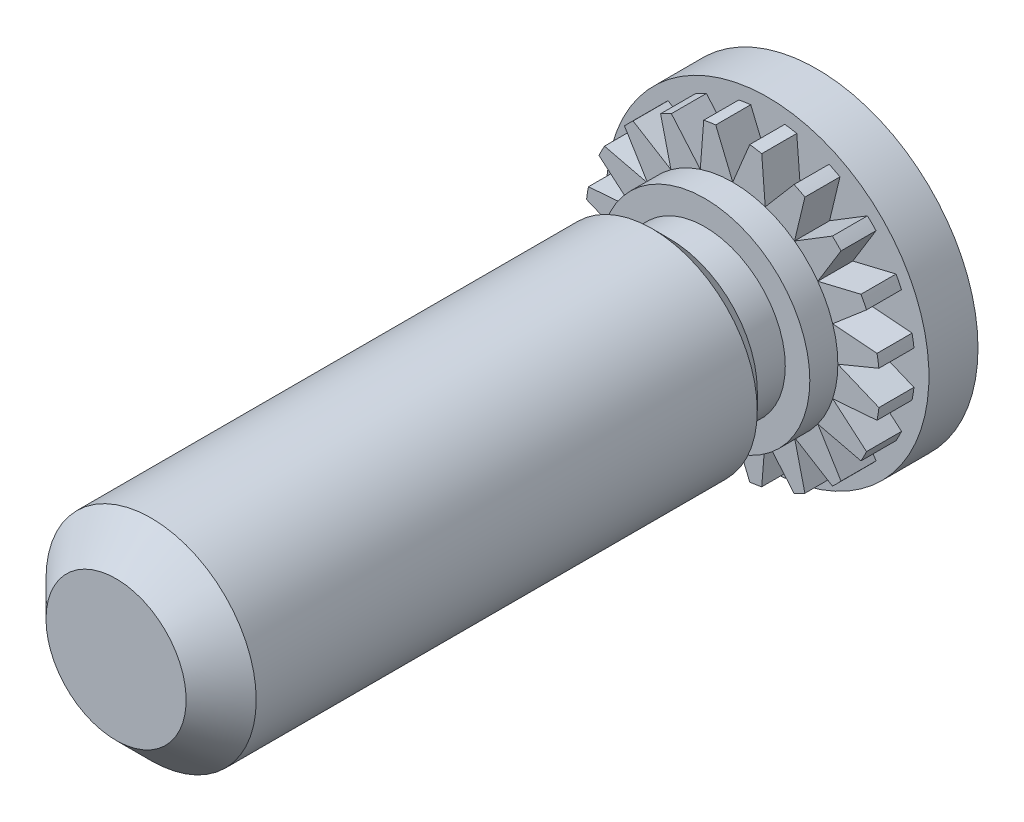
from build123d import *

# Parameters (mm, degrees)
SKETCH_1_R               = 2.3
EXTRUDE_1_DEPTH          = 1.2
SKETCH_2_R               = 1.5
EXTRUDE_2_DEPTH          = 1.5
CUT_EXTRUDE_1_DEPTH      = 0.5
PATTERN_CIRCULAR_1_COUNT = 20
SKETCH_4_W               = 0.35
SKETCH_4_H               = 0.5
SKETCH_6_W               = 7.3
SKETCH_6_H               = 1.5
CHAMFER_2_SIZE           = 0.5
CUT_EXTRUDE_START        = -0.5
SKETCH_7_R               = 2.3
SKETCH_7_R_2             = 2.1
CUT_EXTRUDE_2_DEPTH      = 0.5


with BuildPart() as part:
    # Эскиз1 → Вытянуть1 (new body)
    with BuildSketch(Plane.XY):
        Circle(SKETCH_1_R)
    extrude(amount=EXTRUDE_1_DEPTH)

    # Эскиз2 → Вытянуть2 (add)
    with BuildSketch(Plane.XY.offset(1.2)):
        Circle(SKETCH_2_R)
    extrude(amount=EXTRUDE_2_DEPTH)

    # Эскиз3 → Вырез-Вытянуть1 (cut)
    with BuildSketch(Plane.XY.offset(1.2)):
        Polygon((-0.33137085, 2.3), (0.33137085, 2.3), (0, 1.5), align=None)
    cut_extrude_1 = extrude(amount=-CUT_EXTRUDE_1_DEPTH, mode=Mode.SUBTRACT)

    # Круговой массив1: Вырез-Вытянуть1 ×20 about axis
    pattern_circular_1_axis = Axis((0, 0, 0), (0, 0, 1))
    for i in range(1, PATTERN_CIRCULAR_1_COUNT):
        add(cut_extrude_1.rotate(pattern_circular_1_axis, i * 360 / PATTERN_CIRCULAR_1_COUNT), mode=Mode.SUBTRACT)

    # Эскиз4 → Вырез-Повернуть1 (revolve, cut)
    with BuildSketch(Plane(origin=(0, 0, 0), x_dir=(1, 0, 0), z_dir=(0, 1, 0))):
        with Locations((1.325, -1.85)):
            Rectangle(SKETCH_4_W, SKETCH_4_H)
    revolve(axis=Axis((0, 0, 10.642619983), (0, 0, -1)), mode=Mode.SUBTRACT)

    # Эскиз6 → Повернуть1 (revolve)
    with BuildSketch(Plane(origin=(0, 0, 0), x_dir=(0, 0, -1), z_dir=(1, 0, 0)), mode=Mode.PRIVATE) as revolve_1_sk:
        with Locations((-6.35, -0.75)):
            Rectangle(SKETCH_6_W, SKETCH_6_H)
    revolve(revolve_1_sk.sketch.rotate(Axis((0, 0, 2.7), (0, 0, 1)), 278.047567557), axis=Axis((0, 0, 2.7), (0, 0, 1)))

    # Фаска2
    # the kernel refuses this chamfer: 0.5 mm, written as the material it takes off along each edge
    with BuildSketch(Plane(origin=(0, 0, 10), x_dir=(-0.9901521845161062, -0.1399951838385265, 0), z_dir=(-0.1399951838385265, 0.9901521845161062, 0))) as chamfer_2_piece_1:
        Polygon((1.5, -CHAMFER_2_SIZE), (1.5 - CHAMFER_2_SIZE, 0), (1.5, 0), align=None)
    revolve(axis=Axis((0, 0, 10), (0, 0, 1)), mode=Mode.SUBTRACT)

    # Эскиз7 → Вырез-Вытянуть2 (cut)
    with BuildSketch(Plane.XY.offset(1.2).offset(CUT_EXTRUDE_START)):
        with Locations(Location((0, 0, 0), (0, 0, 180))):
            Circle(SKETCH_7_R)
        Circle(SKETCH_7_R_2, mode=Mode.SUBTRACT)
    extrude(amount=CUT_EXTRUDE_2_DEPTH, mode=Mode.SUBTRACT)

    # Фаска3
    # the kernel refuses this chamfer: 0.25 mm, written as the material it takes off along each edge
    with BuildSketch(Plane(origin=(0, 0, 2.1), x_dir=(1, 0, 0), z_dir=(0, 1, 0))) as chamfer_3_piece_1:
        with BuildLine():
            Line((1.242928932, 0.007071068), (1.507071068, -0.257071068))
            Line((1.507071068, -0.257071068), (1.512071068, -0.257071068))
            ThreePointArc((1.512071068, -0.257071068), (1.505, -0.128535534), (1.505, 0))
            Line((1.505, 0), (1.5, 0.005))
            ThreePointArc((1.5, 0.005), (1.371464466, 0.005), (1.242928932, 0.012071068))
            Line((1.242928932, 0.012071068), (1.242928932, 0.007071068))
        make_face()
    revolve(axis=Axis((0, 0, 2.1), (0, 0, -1)), mode=Mode.SUBTRACT)


solid = part.part
